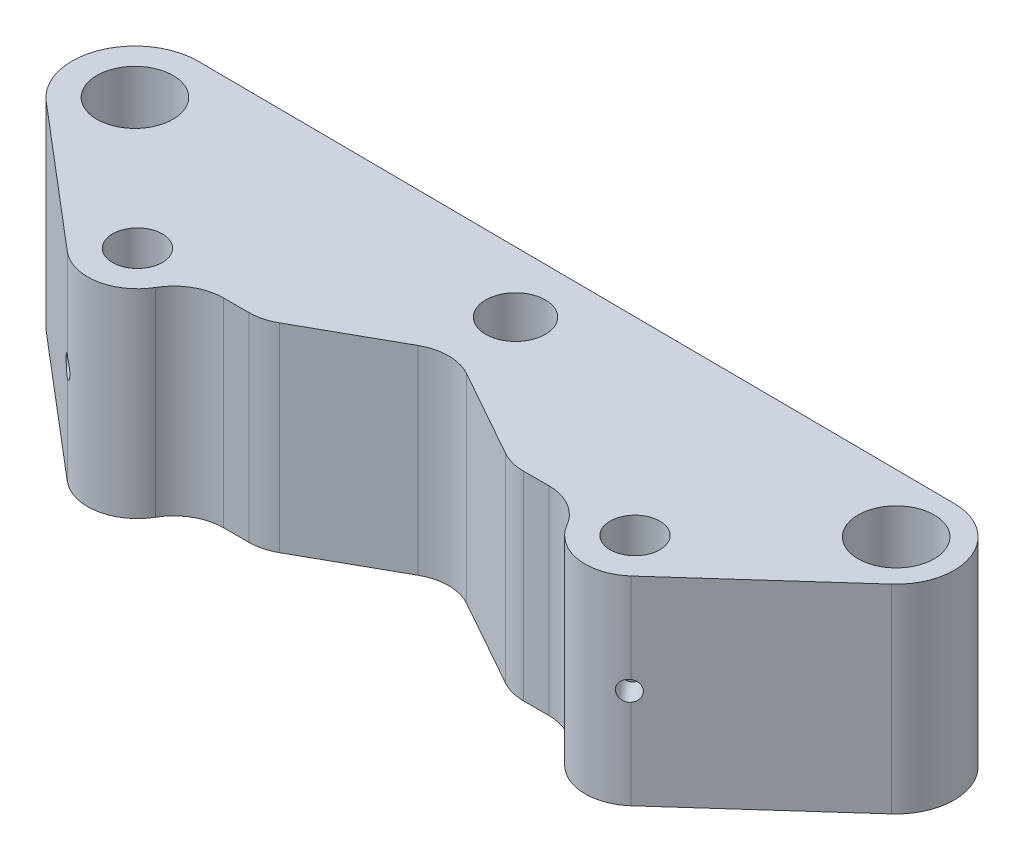
from build123d import *

# Parameters (mm, degrees)
SZKIC1_R                    = 7.65
SZKIC1_R_2                  = 6
SZKIC1_R_3                  = 5
DODANIE_WYCI_GNI_CIE1_DEPTH = 40
SZKIC2_R                    = 11
WYTNIJ_WYCI_GNI_CIE1_DEPTH  = 5
SZKIC3_R                    = 1.25
WYTNIJ_WYCI_GNI_CIE2_DEPTH  = 10
WYTNIJ_WYCI_GNI_CIE3_DEPTH  = 105.133195956
ZAOKR_GLENIE1_R             = 10
SZKIC5_R                    = 2
WYTNIJ_WYCI_GNI_CIE4_DEPTH  = 20


with BuildPart() as part:
    # Szkic1 → Dodanie-wyciągnięcie1 (new body)
    with BuildSketch(Plane(origin=(0, 0, 0), x_dir=(1, 0, 0), z_dir=(0, 1, 0))):
        with BuildLine():
            ThreePointArc((-76.5, 12.65), (-88.373421198, 4.363985457), (-84.69216402, -9.639032559))
            Line((-84.69216402, -9.639032559), (-56.476018988, -33.619788584))
            ThreePointArc((-56.476018988, -33.619788584), (-45.802392937, -35.076348106), (-40, -26))
            Line((-40, -26), (40, -26))
            ThreePointArc((40, -26), (45.925221554, -35.13215093), (56.679236123, -33.442298356))
            Line((56.679236123, -33.442298356), (84.281310083, -8.670277585))
            ThreePointArc((84.281310083, -8.670277585), (87.39314959, 4.130592211), (76.576123228, 11.649751296))
            Line((76.576123228, 11.649751296), (-76.5, 12.65))
        make_face()
        with Locations((-76.5, 0)):
            Circle(SZKIC1_R, mode=Mode.SUBTRACT)
        Circle(SZKIC1_R_2, mode=Mode.SUBTRACT)
        with Locations((76.5, 0)):
            Circle(SZKIC1_R, mode=Mode.SUBTRACT)
        with Locations((50, -26)):
            Circle(SZKIC1_R_3, mode=Mode.SUBTRACT)
        with Locations((-50, -26)):
            Circle(SZKIC1_R_3, mode=Mode.SUBTRACT)
    extrude(amount=DODANIE_WYCI_GNI_CIE1_DEPTH)

    # Szkic2 → Wytnij-wyciągnięcie1 (cut)
    with BuildSketch(Plane.XZ):
        Circle(SZKIC2_R)
    extrude(amount=-WYTNIJ_WYCI_GNI_CIE1_DEPTH, mode=Mode.SUBTRACT)

    # Szkic3 → Wytnij-wyciągnięcie2 (cut)
    with BuildSketch(Plane.XZ.offset(-5)):
        with Locations((-5.656854249, 5.656854249)):
            Circle(SZKIC3_R)
        with Locations((5.656854249, 5.656854249)):
            Circle(SZKIC3_R)
        with Locations((5.656854249, -5.656854249)):
            Circle(SZKIC3_R)
        with Locations((-5.656854249, -5.656854249)):
            Circle(SZKIC3_R)
    extrude(amount=-WYTNIJ_WYCI_GNI_CIE2_DEPTH, mode=Mode.SUBTRACT)

    # Szkic4 → Wytnij-wyciągnięcie3 (cut, through all)
    with BuildSketch(Plane(origin=(0, 40, 0), x_dir=(1, 0, 0), z_dir=(0, 1, 0))):
        Polygon((-25, -26), (0, -12), (25, -26), align=None)
    extrude(amount=-WYTNIJ_WYCI_GNI_CIE3_DEPTH, mode=Mode.SUBTRACT)

    # Zaokrąglenie1
    zaokr_glenie1_edges = [part.edges().sort_by_distance(p)[0] for p in [
        (40, 20, 26),
        (-40, 20, 26),
        (25, 20, 26),
        (0, 20, 12),
        (-25, 20, 26),
    ]]
    fillet(zaokr_glenie1_edges, radius=ZAOKR_GLENIE1_R)

    # Szkic5 → Wytnij-wyciągnięcie4 (cut)
    with BuildSketch(Plane(origin=(-40.2753628, 0, 47.388642659), x_dir=(0.761978858404398, 0, 0.647601898811863), z_dir=(-0.6476018988118629, 0, 0.7619788584043979))):
        with Locations((-21.261293551, 20)):
            Circle(SZKIC5_R)
    wytnij_wyci_gni_cie4 = extrude(amount=-WYTNIJ_WYCI_GNI_CIE4_DEPTH, mode=Mode.SUBTRACT)

    # Lustro1: Wytnij-wyciągnięcie4 across plane
    add(wytnij_wyci_gni_cie4.mirror(Plane(origin=(0, 0, 0), x_dir=(0, 0, 1), z_dir=(1, 0, 0))), mode=Mode.SUBTRACT)


solid = part.part
